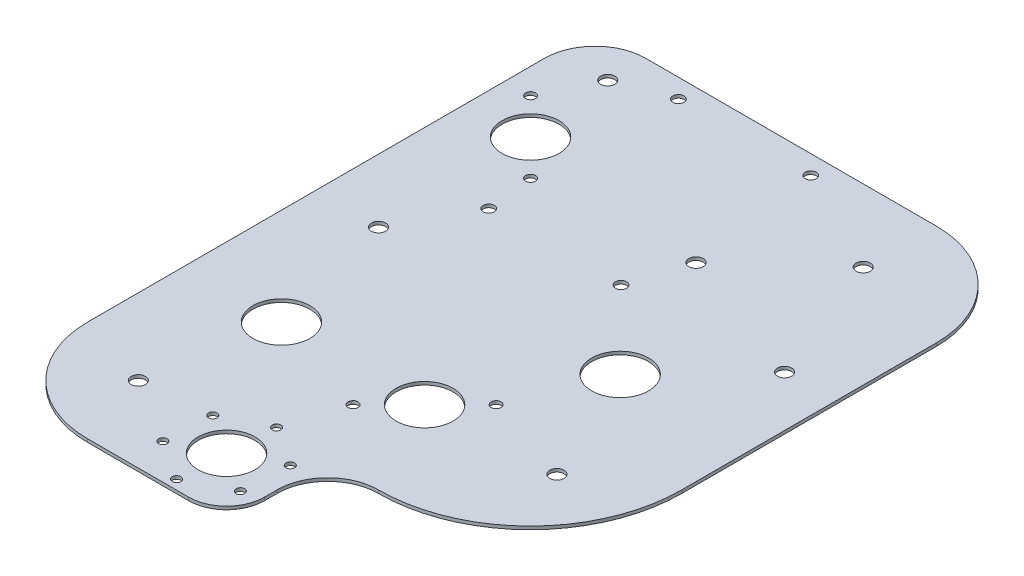
from build123d import *

# Parameters (mm, degrees)
SKETCH1_W               = 222.123
SKETCH1_H               = 254.783638074
SKETCH1_R               = 14.2875
SKETCH1_R_2             = 1.27
BOSS_EXTRUDE1_DEPTH     = 1.5875
F_10_CLEARANCE_HOLE1_D  = 4.9784
SKETCH4_R               = 2.8067
CUT_EXTRUDE1_DEPTH      = 170.014355888
SKETCH5_R               = 1.5875
CUT_EXTRUDE2_DEPTH      = 170.014355888
SKETCH6_W               = 222.123
SKETCH6_H               = 1.5875
BOSS_EXTRUDE2_DEPTH     = 50.8
SKETCH7_W               = 101.6
SKETCH7_H               = 50.8
CUT_EXTRUDE3_DEPTH      = 210.975001632
SKETCH8_R               = 14.2875
CUT_EXTRUDE5_DEPTH      = 210.975001632
SKETCH9_R               = 2.15
CUT_EXTRUDE6_DEPTH      = 210.975001632
SKETCH10_R              = 14.2875
SKETCH10_R_2            = 1.27
CUT_EXTRUDE7_DEPTH      = 210.975001632
F_10_CLEARANCE_HOLE2_D  = 4.9784
CUT_EXTRUDE8_DEPTH      = 210.975001632
CUT_EXTRUDE9_DEPTH      = 210.975001632
FILLET1_R               = 25.4
CUT_EXTRUDE10_DEPTH     = 210.975001632
CUT_EXTRUDE11_DEPTH     = 210.975001632
CUT_EXTRUDE13_DEPTH     = 210.975001632
SKETCH18_R              = 1.27
CUT_EXTRUDE14_DEPTH     = 210.975001632
F_1_4_CLEARANCE_HOLE1_D = 7.14248


with BuildPart() as part:
    # Sketch1 → Boss-Extrude1 (new body)
    with BuildSketch(Plane(origin=(0, 0, 0), x_dir=(1, 0, 0), z_dir=(0, 1, 0))):
        Rectangle(SKETCH1_W, SKETCH1_H)
        with Locations(Location((9.4615, -78.750819037, 0), (0, 0, 270))):
            Circle(SKETCH1_R, mode=Mode.SUBTRACT)
        with Locations(Location((45.4025, -16.499180963, 0), (0, 0, 270))):
            Circle(SKETCH1_R, mode=Mode.SUBTRACT)
        with Locations(Location((-62.4205, -78.750819037, 0), (0, 0, 270))):
            Circle(SKETCH1_R, mode=Mode.SUBTRACT)
        with Locations(Location((-8.499012242, -96.71133128, 0), (0, 0, 270))):
            Circle(SKETCH1_R_2, mode=Mode.SUBTRACT)
        with Locations(Location((27.422012242, -60.790306795, 0), (0, 0, 270))):
            Circle(SKETCH1_R_2, mode=Mode.SUBTRACT)
    extrude(amount=BOSS_EXTRUDE1_DEPTH)

    # #10 Clearance Hole1 (through all)
    with Locations(Plane(origin=(0, 1.5875, 0), x_dir=(1, 0, 0), z_dir=(0, 1, 0))):
        with Locations((-8.499012242, -96.71133128), (27.422012242, -60.790306795)):
            Hole(F_10_CLEARANCE_HOLE1_D / 2)

    # Sketch4 → Cut-Extrude1 (cut, through all)
    with BuildSketch(Plane(origin=(0, 0, 0), x_dir=(-1, 0, 0), z_dir=(0, -1, 0))):
        with Locations(Location((59.692539866, 117.866819037, 0), (0, 0, 90))):
            Circle(SKETCH4_R)
        with Locations(Location((59.692539866, 22.616819037, 0), (0, 0, 90))):
            Circle(SKETCH4_R)
        with Locations(Location((-6.733539866, 117.866819037, 0), (0, 0, 90))):
            Circle(SKETCH4_R)
        with Locations(Location((-6.733539866, 22.616819037, 0), (0, 0, 90))):
            Circle(SKETCH4_R)
    extrude(amount=-CUT_EXTRUDE1_DEPTH, mode=Mode.SUBTRACT)

    # Sketch5 → Cut-Extrude2 (cut, through all)
    with BuildSketch(Plane.XZ):
        with Locations(Location((59.770116522, -91.195174152, 0), (0, 0, 270))):
            Circle(SKETCH5_R)
    extrude(amount=-CUT_EXTRUDE2_DEPTH, mode=Mode.SUBTRACT)

    # Sketch6 → Boss-Extrude2 (add)
    with BuildSketch(Plane.XY.offset(127.391819037)):
        with Locations((0, 0.79375)):
            Rectangle(SKETCH6_W, SKETCH6_H)
    extrude(amount=BOSS_EXTRUDE2_DEPTH)

    # Sketch7 → Cut-Extrude3 (cut, through all)
    with BuildSketch(Plane(origin=(0, 0, 0), x_dir=(-1, 0, 0), z_dir=(0, -1, 0))):
        with Locations((-60.2615, -152.791819037)):
            Rectangle(SKETCH7_W, SKETCH7_H)
    extrude(amount=-CUT_EXTRUDE3_DEPTH, mode=Mode.SUBTRACT)

    # Sketch8 → Cut-Extrude5 (cut, through all)
    with BuildSketch(Plane(origin=(0, 1.5875, 0), x_dir=(1, 0, 0), z_dir=(0, 1, 0))):
        with Locations(Location((-19.1135, -149.616819037, 0), (0, 0, 270))):
            Circle(SKETCH8_R)
    extrude(amount=-CUT_EXTRUDE5_DEPTH, mode=Mode.SUBTRACT)

    # Sketch9 → Cut-Extrude6 (cut, through all)
    with BuildSketch(Plane(origin=(0, 1.5875, 0), x_dir=(1, 0, 0), z_dir=(0, 1, 0))):
        with Locations(Location((-17.801836865, -125.840471629, 0), (0, 0, 270))):
            Circle(SKETCH9_R)
        with Locations(Location((2.133252432, -138.86457893, 0), (0, 0, 270))):
            Circle(SKETCH9_R)
        with Locations(Location((0.821589297, -162.640926338, 0), (0, 0, 270))):
            Circle(SKETCH9_R)
        with Locations(Location((-20.425163135, -173.393166445, 0), (0, 0, 270))):
            Circle(SKETCH9_R)
        with Locations(Location((-40.360252432, -160.369059145, 0), (0, 0, 270))):
            Circle(SKETCH9_R)
        with Locations(Location((-39.048589297, -136.592711737, 0), (0, 0, 270))):
            Circle(SKETCH9_R)
    extrude(amount=-CUT_EXTRUDE6_DEPTH, mode=Mode.SUBTRACT)

    # Sketch10 → Cut-Extrude7 (cut, through all)
    with BuildSketch(Plane(origin=(0, 0, 0), x_dir=(-1, 0, 0), z_dir=(0, -1, 0))):
        with Locations(Location((80.318324186, 64.242728022, 0), (0, 0, 90))):
            Circle(SKETCH10_R)
        with Locations(Location((62.357811944, 46.28221578, 0), (0, 0, 90))):
            Circle(SKETCH10_R_2)
        with Locations(Location((98.278836428, 82.203240264, 0), (0, 0, 90))):
            Circle(SKETCH10_R_2)
    extrude(amount=-CUT_EXTRUDE7_DEPTH, mode=Mode.SUBTRACT)

    # #10 Clearance Hole2 (through all)
    with Locations(Plane(origin=(0, 0, 0), x_dir=(-1, 0, 0), z_dir=(0, -1, 0))):
        with Locations((98.278836428, 82.203240264), (62.357811944, 46.28221578)):
            Hole(F_10_CLEARANCE_HOLE2_D / 2)

    # Sketch13 → Cut-Extrude8 (cut, through all)
    with BuildSketch(Plane(origin=(0, 1.5875, 0), x_dir=(1, 0, 0), z_dir=(0, 1, 0))):
        with BuildLine():
            Line((60.2615, 127.391819037), (111.0615, 127.391819037))
            Line((111.0615, 127.391819037), (111.0615, 76.591819037))
            ThreePointArc((111.0615, 76.591819037), (96.182524484, 112.512843522), (60.2615, 127.391819037))
        make_face()
    extrude(amount=-CUT_EXTRUDE8_DEPTH, mode=Mode.SUBTRACT)

    # Sketch14 → Cut-Extrude9 (cut, through all)
    with BuildSketch(Plane(origin=(0, 1.5875, 0), x_dir=(1, 0, 0), z_dir=(0, 1, 0))):
        with BuildLine():
            Line((34.8615, -127.391819037), (111.0615, -127.391819037))
            Line((111.0615, -127.391819037), (111.0615, -51.191819037))
            ThreePointArc((111.0615, -51.191819037), (88.743036726, -105.073355764), (34.8615, -127.391819037))
        make_face()
    extrude(amount=-CUT_EXTRUDE9_DEPTH, mode=Mode.SUBTRACT)

    # Fillet1
    fillet1_edges = [part.edges().sort_by_distance(p)[0] for p in [
        (9.4615, 0.79375, 127.391819037),
    ]]
    fillet(fillet1_edges, radius=FILLET1_R - 0.0001)  # a hair under: the kernel refuses the full size

    # Sketch15 → Cut-Extrude10 (cut, through all)
    with BuildSketch(Plane(origin=(0, 1.5875, 0), x_dir=(1, 0, 0), z_dir=(0, 1, 0))):
        with BuildLine():
            Line((-111.0615, 101.991819037), (-111.0615, 127.391819037))
            Line((-111.0615, 127.391819037), (-85.6615, 127.391819037))
            ThreePointArc((-85.6615, 127.391819037), (-103.622012242, 119.95233128), (-111.0615, 101.991819037))
        make_face()
    extrude(amount=-CUT_EXTRUDE10_DEPTH, mode=Mode.SUBTRACT)

    # Sketch16 → Cut-Extrude11 (cut, through all)
    with BuildSketch(Plane(origin=(0, 1.5875, 0), x_dir=(1, 0, 0), z_dir=(0, 1, 0))):
        with BuildLine():
            Line((-111.0615, -127.391819037), (-111.0615, -178.191819037))
            Line((-111.0615, -178.191819037), (-60.2615, -178.191819037))
            ThreePointArc((-60.2615, -178.191819037), (-96.182524484, -163.312843522), (-111.0615, -127.391819037))
        make_face()
    extrude(amount=-CUT_EXTRUDE11_DEPTH, mode=Mode.SUBTRACT)

    # Sketch17 → Cut-Extrude13 (cut, through all)
    with BuildSketch(Plane(origin=(0, 1.5875, 0), x_dir=(1, 0, 0), z_dir=(0, 1, 0))):
        with BuildLine():
            Line((9.4615, -178.191819037), (9.4615, -159.141819037))
            ThreePointArc((9.4615, -159.141819037), (3.881884182, -172.612203219), (-9.5885, -178.191819037))
            Line((-9.5885, -178.191819037), (9.4615, -178.191819037))
        make_face()
    extrude(amount=-CUT_EXTRUDE13_DEPTH, mode=Mode.SUBTRACT)

    # Sketch18 → Cut-Extrude14 (cut, through all)
    with BuildSketch(Plane(origin=(0, 1.5875, 0), x_dir=(1, 0, 0), z_dir=(0, 1, 0))):
        with Locations(Location((72.9615, -75.808180963, 0), (0, 0, 270))):
            Circle(SKETCH18_R)
        with Locations(Location((85.6615, 25.791819037, 0), (0, 0, 270))):
            Circle(SKETCH18_R)
        with Locations(Location((15.8115, 51.191819037, 0), (0, 0, 270))):
            Circle(SKETCH18_R)
        with Locations(Location((-85.6615, 108.341819037, 0), (0, 0, 270))):
            Circle(SKETCH18_R)
        with Locations(Location((-79.3115, -13.091819037, 0), (0, 0, 270))):
            Circle(SKETCH18_R)
        with Locations(Location((-72.9615, -140.091819037, 0), (0, 0, 270))):
            Circle(SKETCH18_R)
    extrude(amount=-CUT_EXTRUDE14_DEPTH, mode=Mode.SUBTRACT)

    # 1/4 Clearance Hole1 (through all)
    with Locations(Plane(origin=(0, 1.5875, 0), x_dir=(1, 0, 0), z_dir=(0, 1, 0))):
        with Locations((-72.9615, -140.091819037), (72.9615, -75.808180963), (85.6615, 25.791819037), (15.8115, 51.191819037), (59.770116522, 91.195174152), (-79.3115, -13.091819037), (-85.6615, 108.341819037)):
            Hole(F_1_4_CLEARANCE_HOLE1_D / 2)


solid = part.part
